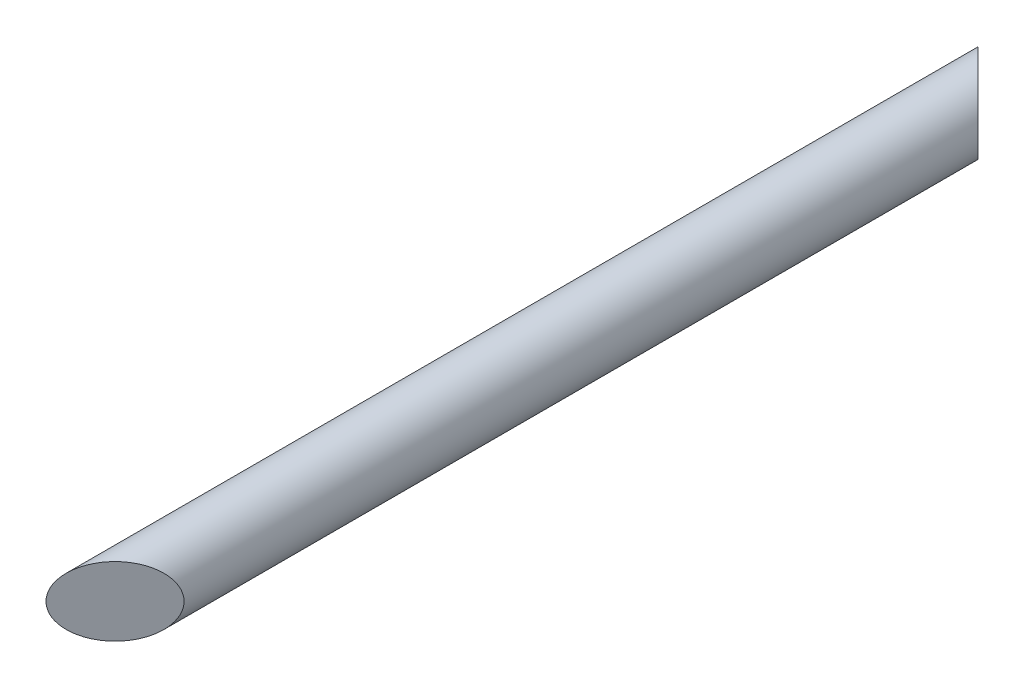
from build123d import *

# Parameters (mm, degrees)
SKETCH1_R           = 30
BOSS_EXTRUDE2_DEPTH = 810
CUT_EXTRUDE1_DEPTH  = 70
CUT_EXTRUDE2_DEPTH  = 70


with BuildPart() as part:
    # Sketch1 → Boss-Extrude2 (new body)
    with BuildSketch(Plane.XY):
        Circle(SKETCH1_R)
    extrude(amount=BOSS_EXTRUDE2_DEPTH)

    # Sketch4 → Cut-Extrude1 (cut)
    with BuildSketch(Plane(origin=(0, 40, 0), x_dir=(1, 0, 0), z_dir=(0, 1, 0))):
        Polygon((-30, -810), (30, -810), (30, -750), align=None)
    extrude(amount=-CUT_EXTRUDE1_DEPTH, mode=Mode.SUBTRACT)

    # Sketch3 → Cut-Extrude2 (cut)
    with BuildSketch(Plane(origin=(0, 40, 0), x_dir=(1, 0, 0), z_dir=(0, 1, 0))):
        Polygon((-30, 0), (30, -60), (30, 0), align=None)
    extrude(amount=-CUT_EXTRUDE2_DEPTH, mode=Mode.SUBTRACT)


solid = part.part
